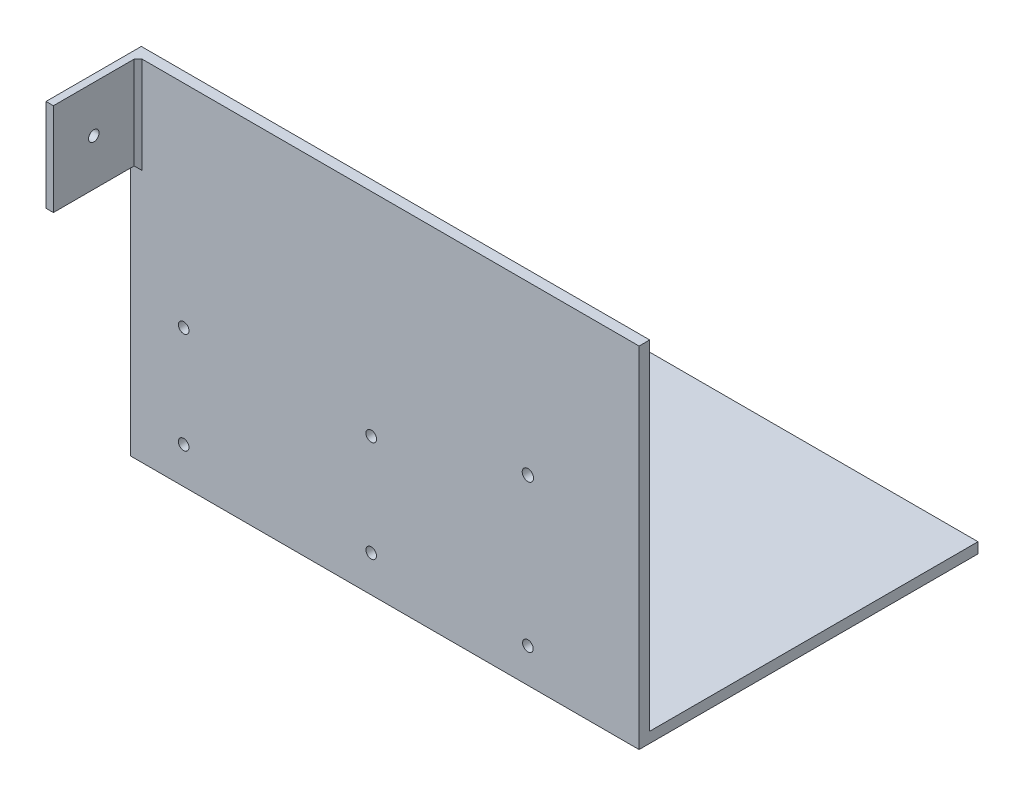
from build123d import *

# Parameters (mm, degrees)
SKETCH1_W           = 304.8
SKETCH1_H           = 203.2
BOSS_EXTRUDE1_DEPTH = 6.35
SKETCH2_W           = 304.8
SKETCH2_H           = 6.35
BOSS_EXTRUDE2_DEPTH = 40.64
SKETCH3_W           = 20.403275231
SKETCH3_H           = 40.64
CUT_EXTRUDE1_DEPTH  = 325.70549749
SKETCH2_2_W         = 304.8
SKETCH2_2_H         = 6.35
BOSS_EXTRUDE3_DEPTH = 203.2
SKETCH9_R           = 3.175
CUT_EXTRUDE2_DEPTH  = 10.922
SKETCH10_R          = 3.175
SKETCH10_R_2        = 3.392842108
CUT_EXTRUDE3_DEPTH  = 10.922
SKETCH11_W          = 4.440800547
SKETCH11_H          = 55.485459727
BOSS_EXTRUDE7_DEPTH = 50.8
CHAMFER1_SIZE       = 2.38
SKETCH12_W          = 5.089607789
SKETCH12_H          = 51.20183316
BOSS_EXTRUDE8_DEPTH = 50.8
CHAMFER2_SIZE       = 2.38
SKETCH13_R          = 3.175
CUT_EXTRUDE4_DEPTH  = 50.8
SKETCH14_R          = 3.175
CUT_EXTRUDE5_DEPTH  = 50.8


with BuildPart() as part:
    # Sketch1 → Boss-Extrude1 (new body)
    with BuildSketch(Plane(origin=(0, 0, 0), x_dir=(1, 0, 0), z_dir=(0, 1, 0))):
        Rectangle(SKETCH1_W, SKETCH1_H)
    extrude(amount=BOSS_EXTRUDE1_DEPTH)

    # Sketch2 → Boss-Extrude2 (add)
    with BuildSketch(Plane(origin=(0, 6.35, 0), x_dir=(1, 0, 0), z_dir=(0, 1, 0))):
        with Locations((0, -98.425)):
            Rectangle(SKETCH2_W, SKETCH2_H)
    extrude(amount=BOSS_EXTRUDE2_DEPTH)

    # Sketch3 → Cut-Extrude1 (cut, through all)
    with BuildSketch(Plane(origin=(152.4, 0, 0), x_dir=(0, 0, -1), z_dir=(1, 0, 0))):
        with Locations((-91.398362385, 26.67)):
            Rectangle(SKETCH3_W, SKETCH3_H)
        with Locations((91.398362385, 26.67)):
            Rectangle(SKETCH3_W, SKETCH3_H)
    extrude(amount=-CUT_EXTRUDE1_DEPTH, mode=Mode.SUBTRACT)

    # Sketch2<2> → Boss-Extrude3 (add)
    with BuildSketch(Plane(origin=(0, 6.35, 0), x_dir=(1, 0, 0), z_dir=(0, 1, 0))):
        with Locations((0, -98.425)):
            Rectangle(SKETCH2_2_W, SKETCH2_2_H)
    extrude(amount=BOSS_EXTRUDE3_DEPTH)

    # Sketch9 → Cut-Extrude2 (cut)
    with BuildSketch(Plane.XZ):
        with Locations((-120.65, 79.078648077)):
            Circle(SKETCH9_R)
        with Locations((-120.65, 18.102975355)):
            Circle(SKETCH9_R)
        with Locations((-8.205, 79.078648077)):
            Circle(SKETCH9_R)
        with Locations((-8.205, 18.102975355)):
            Circle(SKETCH9_R)
        with Locations((85.7212, 73.627514031)):
            Circle(SKETCH9_R)
    extrude(amount=-CUT_EXTRUDE2_DEPTH, mode=Mode.SUBTRACT)

    # Sketch10 → Cut-Extrude3 (cut)
    with BuildSketch(Plane.XY.offset(101.6)):
        with Locations((-120.65, 82.55)):
            Circle(SKETCH10_R)
        with Locations((-120.65, 21.89944615)):
            Circle(SKETCH10_R)
        with Locations((-8.205, 82.46463474)):
            Circle(SKETCH10_R)
        with Locations((-8.205, 21.81408089)):
            Circle(SKETCH10_R)
        with Locations((85.7212, 20.555650908)):
            Circle(SKETCH10_R)
        with Locations((85.7212, 109.224080666)):
            Circle(SKETCH10_R_2)
    extrude(amount=-CUT_EXTRUDE3_DEPTH, mode=Mode.SUBTRACT)

    # Sketch11 → Boss-Extrude7 (add)
    with BuildSketch(Plane.XY.offset(101.6)):
        with Locations((-150.179599726, 181.807270136)):
            Rectangle(SKETCH11_W, SKETCH11_H)
    extrude(amount=BOSS_EXTRUDE7_DEPTH)

    # Chamfer1
    chamfer1_edges = [part.edges().sort_by_distance(p)[0] for p in [
        (-147.959199453, 181.807270136, 101.6),
        (-150.179599726, 154.064540273, 101.6),
    ]]
    chamfer(chamfer1_edges, length=CHAMFER1_SIZE)

    # Sketch12 → Boss-Extrude8 (add)
    with BuildSketch(Plane.XZ):
        with Locations((-149.855196105, -75.99908342)):
            Rectangle(SKETCH12_W, SKETCH12_H)
    extrude(amount=BOSS_EXTRUDE8_DEPTH)

    # Chamfer2
    chamfer2_edges = [part.edges().sort_by_distance(p)[0] for p in [
        (-149.855196105, 0, -50.39816684),
        (-147.310392211, 0, -75.99908342),
    ]]
    chamfer(chamfer2_edges, length=CHAMFER2_SIZE)

    # Sketch13 → Cut-Extrude4 (cut)
    with BuildSketch(Plane(origin=(-147.310392211, 0, 0), x_dir=(0, 0, -1), z_dir=(1, 0, 0))):
        with Locations((75.99908342, -26.59)):
            Circle(SKETCH13_R)
    extrude(amount=-CUT_EXTRUDE4_DEPTH, mode=Mode.SUBTRACT)

    # Sketch14 → Cut-Extrude5 (cut)
    with BuildSketch(Plane(origin=(-147.959199453, 0, 0), x_dir=(0, 0, -1), z_dir=(1, 0, 0))):
        with Locations((-128.19, 181.807270136)):
            Circle(SKETCH14_R)
    extrude(amount=-CUT_EXTRUDE5_DEPTH, mode=Mode.SUBTRACT)


solid = part.part
